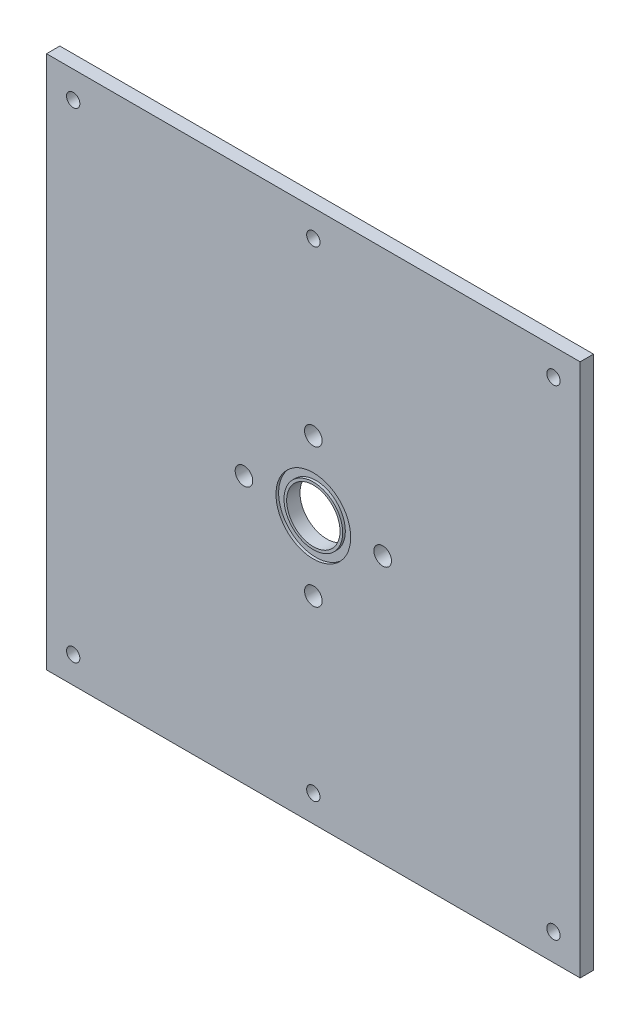
from build123d import *

# Parameters (mm, degrees)
SKETCH_1_W          = 200
SKETCH_1_H          = 200
SKETCH_1_R          = 10
EXTRUDE_1_DEPTH     = 5
SKETCH_2_R          = 14
SKETCH_2_R_2        = 11
CUT_EXTRUDE_1_DEPTH = 1
SKETCH_3_R          = 2.5
CUT_EXTRUDE_2_DEPTH = 142.509716981
SKETCH_5_R          = 3.3
CUT_EXTRUDE_4_DEPTH = 142.509716981


with BuildPart() as part:
    # ｽｹｯﾁ1 → ﾎﾞｽ - 押し出し1 (new body)
    with BuildSketch(Plane.XY):
        Rectangle(SKETCH_1_W, SKETCH_1_H)
        Circle(SKETCH_1_R, mode=Mode.SUBTRACT)
    extrude(amount=EXTRUDE_1_DEPTH)

    # ｽｹｯﾁ2 → ｶｯﾄ - 押し出し1 (cut)
    with BuildSketch(Plane.XY.offset(5)):
        Circle(SKETCH_2_R)
        Circle(SKETCH_2_R_2, mode=Mode.SUBTRACT)
    extrude(amount=-CUT_EXTRUDE_1_DEPTH, mode=Mode.SUBTRACT)

    # ｽｹｯﾁ3 → ｶｯﾄ - 押し出し2 (cut, through all)
    with BuildSketch(Plane.XY.offset(5)):
        with Locations((0, 90)):
            Circle(SKETCH_3_R)
        with Locations((90, 90)):
            Circle(SKETCH_3_R)
        with Locations((-90, 90)):
            Circle(SKETCH_3_R)
        with Locations((-90, -90)):
            Circle(SKETCH_3_R)
        with Locations((0, -90)):
            Circle(SKETCH_3_R)
        with Locations((90, -90)):
            Circle(SKETCH_3_R)
    extrude(amount=-CUT_EXTRUDE_2_DEPTH, mode=Mode.SUBTRACT)

    # ｽｹｯﾁ5 → ｶｯﾄ - 押し出し4 (cut, through all)
    with BuildSketch(Plane(origin=(0, 0, 0), x_dir=(-1, 0, 0), z_dir=(0, 0, -1))):
        with Locations((-26, 0)):
            Circle(SKETCH_5_R)
        with Locations((0, -26)):
            Circle(SKETCH_5_R)
        with Locations((26, 0)):
            Circle(SKETCH_5_R)
        with Locations((0, 26)):
            Circle(SKETCH_5_R)
    extrude(amount=-CUT_EXTRUDE_4_DEPTH, mode=Mode.SUBTRACT)


solid = part.part
